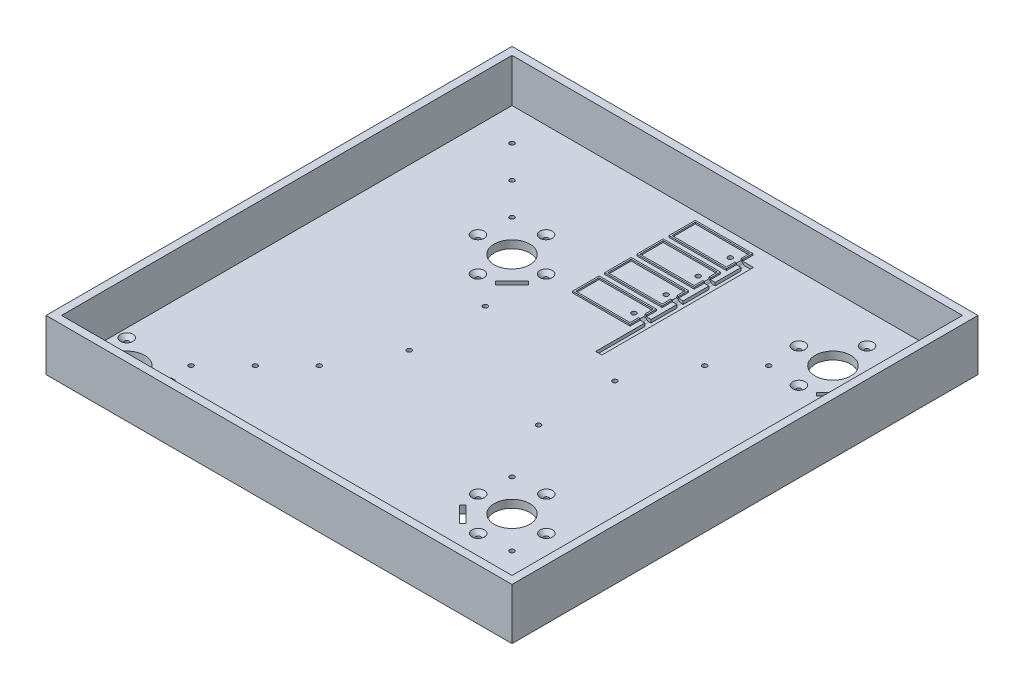
from build123d import *

# Parameters (mm, degrees)
SKETCH_1_W           = 300
SKETCH_1_H           = 300
SKETCH_1_R           = 11.5
SKETCH_1_R_2         = 1.5
EXTRUDE_1_DEPTH      = 5
SKETCH_2_W           = 5
SKETCH_2_H           = 300
EXTRUDE_2_DEPTH      = 28
SKETCH_3_W           = 5
SKETCH_3_H           = 300
EXTRUDE_3_DEPTH      = 28
SKETCH_4_W           = 290
SKETCH_4_H           = 5
EXTRUDE_4_DEPTH      = 28
SKETCH_5_W           = 290
SKETCH_5_H           = 5
EXTRUDE_5_DEPTH      = 28
CHAMFER_1_SIZE       = 2.5
CHAMFER_2_SIZE       = 2.5
CHAMFER_3_SIZE       = 2.5
CHAMFER_4_SIZE       = 2.5
CHAMFER_5_SIZE       = 2.5
SKETCH_6_W           = 37
SKETCH_6_H           = 17
SKETCH_6_W_2         = 35
SKETCH_6_H_2         = 15
EXTRUDE_6_DEPTH      = 1
SKETCH_7_W           = 37
SKETCH_7_H           = 17
SKETCH_7_W_2         = 35
SKETCH_7_H_2         = 15
EXTRUDE_7_DEPTH      = 1
SKETCH_8_W           = 37
SKETCH_8_H           = 17
SKETCH_8_W_2         = 35
SKETCH_8_H_2         = 15
EXTRUDE_8_DEPTH      = 1
SKETCH_8_2_W         = 37
SKETCH_8_2_H         = 17
SKETCH_8_2_W_2       = 35
SKETCH_8_2_H_2       = 15
EXTRUDE_9_DEPTH      = 1
SKETCH_10_W          = 37
SKETCH_10_H          = 17
SKETCH_10_W_2        = 35
SKETCH_10_H_2        = 15
EXTRUDE_10_DEPTH     = 1
CUT_EXTRUDE_1_DEPTH  = 2
SKETCH_12_W          = 1
SKETCH_12_H          = 4
CUT_EXTRUDE_2_DEPTH  = 2
SKETCH_13_W          = 4
SKETCH_13_H          = 93.669015838
CUT_EXTRUDE_3_DEPTH  = 2
CUT_EXTRUDE_4_DEPTH  = 2
SKETCH_15_W          = 3
SKETCH_15_H          = 4
CUT_EXTRUDE_5_DEPTH  = 2
FILLET_1_R           = 2
FILLET_2_R           = 2
FILLET_3_R           = 2
FILLET_5_R           = 2
FILLET_6_R           = 2
FILLET_7_R           = 2
CUT_EXTRUDE_6_DEPTH  = 2
SKETCH_17_W          = 3
SKETCH_17_H          = 4.004139154
CUT_EXTRUDE_8_DEPTH  = 2
FILLET_10_R          = 2
FILLET_11_R          = 2
FILLET_12_R          = 2
CUT_EXTRUDE_9_DEPTH  = 2
SKETCH_19_W          = 3
SKETCH_19_H          = 3.996204012
CUT_EXTRUDE_10_DEPTH = 2
FILLET_15_R          = 2
FILLET_17_R          = 1
FILLET_18_R          = 2


# Some blends are built 0.0001 mm under size
with BuildPart() as part:
    # Эскиз1 → Бобышка-Вытянуть1 (new body)
    with BuildSketch(Plane(origin=(0, 0, 0), x_dir=(1, 0, 0), z_dir=(0, 1, 0))):
        with Locations((13.889751591, -46.476805254)):
            Rectangle(SKETCH_1_W, SKETCH_1_H)
        with Locations(Location((-48.131063689, 15.544010026, 0), (0, 0, 270))):
            Circle(SKETCH_1_R, mode=Mode.SUBTRACT)
        with Locations(Location((-89.42609971, 56.839046048, 0), (0, 0, 270))):
            Circle(SKETCH_1_R_2, mode=Mode.SUBTRACT)
        with Locations(Location((-110.109177008, 77.522123345, 0), (0, 0, 270))):
            Circle(SKETCH_1_R_2, mode=Mode.SUBTRACT)
        with Locations(Location((-110.110248409, -170.476805254, 0), (0, 0, 270))):
            Circle(SKETCH_1_R, mode=Mode.SUBTRACT)
        with Locations(Location((-125.610248409, -154.976805254, 0), (0, 0, 270))):
            Circle(SKETCH_1_R_2, mode=Mode.SUBTRACT)
        with Locations(Location((-125.610248409, -185.976805254, 0), (0, 0, 270))):
            Circle(SKETCH_1_R_2, mode=Mode.SUBTRACT)
        with Locations(Location((-94.610248409, -185.976805254, 0), (0, 0, 270))):
            Circle(SKETCH_1_R_2, mode=Mode.SUBTRACT)
        with Locations(Location((-89.42609971, -149.792656555, 0), (0, 0, 270))):
            Circle(SKETCH_1_R_2, mode=Mode.SUBTRACT)
        with Locations(Location((-68.7785817, -129.145138545, 0), (0, 0, 270))):
            Circle(SKETCH_1_R_2, mode=Mode.SUBTRACT)
        with Locations(Location((-48.131063689, -108.497620534, 0), (0, 0, 270))):
            Circle(SKETCH_1_R_2, mode=Mode.SUBTRACT)
        with Locations(Location((-68.7785817, 36.191528037, 0), (0, 0, 270))):
            Circle(SKETCH_1_R_2, mode=Mode.SUBTRACT)
        with Locations(Location((-48.131063689, 37.464321001, 0), (0, 0, 270))):
            Circle(SKETCH_1_R_2, mode=Mode.SUBTRACT)
        with Locations(Location((-70.051373148, 15.544010026, 0), (0, 0, 270))):
            Circle(SKETCH_1_R_2, mode=Mode.SUBTRACT)
        with Locations(Location((-26.21075423, 15.544010026, 0), (0, 0, 270))):
            Circle(SKETCH_1_R_2, mode=Mode.SUBTRACT)
        with Locations(Location((-48.131063689, -6.376300948, 0), (0, 0, 270))):
            Circle(SKETCH_1_R_2, mode=Mode.SUBTRACT)
        with Locations(Location((75.910566871, -108.497620534, 0), (0, 0, 270))):
            Circle(SKETCH_1_R_2, mode=Mode.SUBTRACT)
        with Locations(Location((96.558084882, -129.145138545, 0), (0, 0, 270))):
            Circle(SKETCH_1_R, mode=Mode.SUBTRACT)
        with Locations(Location((117.205602893, -149.792656555, 0), (0, 0, 270))):
            Circle(SKETCH_1_R_2, mode=Mode.SUBTRACT)
        with Locations(Location((137.888476242, -170.475529905, 0), (0, 0, 270))):
            Circle(SKETCH_1_R_2, mode=Mode.SUBTRACT)
        with Locations(Location((96.558084882, -107.056013031, 0), (0, 0, 270))):
            Circle(SKETCH_1_R_2, mode=Mode.SUBTRACT)
        with Locations(Location((74.637774665, -128.976323247, 0), (0, 0, 270))):
            Circle(SKETCH_1_R_2, mode=Mode.SUBTRACT)
        with Locations(Location((96.558084882, -150.896633464, 0), (0, 0, 270))):
            Circle(SKETCH_1_R_2, mode=Mode.SUBTRACT)
        with Locations(Location((118.478395099, -128.976323247, 0), (0, 0, 270))):
            Circle(SKETCH_1_R_2, mode=Mode.SUBTRACT)
        with Locations(Location((75.910566871, 15.544010026, 0), (0, 0, 270))):
            Circle(SKETCH_1_R_2, mode=Mode.SUBTRACT)
        with Locations(Location((96.558084882, 36.191528037, 0), (0, 0, 270))):
            Circle(SKETCH_1_R_2, mode=Mode.SUBTRACT)
        with Locations(Location((117.205602893, 56.839046048, 0), (0, 0, 270))):
            Circle(SKETCH_1_R, mode=Mode.SUBTRACT)
        with Locations(Location((137.888476242, 77.521919397, 0), (0, 0, 270))):
            Circle(SKETCH_1_R_2, mode=Mode.SUBTRACT)
        with Locations(Location((117.205602893, 78.759354557, 0), (0, 0, 270))):
            Circle(SKETCH_1_R_2, mode=Mode.SUBTRACT)
        with Locations(Location((95.285290968, 56.839046048, 0), (0, 0, 270))):
            Circle(SKETCH_1_R_2, mode=Mode.SUBTRACT)
        with Locations(Location((139.125914817, 56.839046048, 0), (0, 0, 270))):
            Circle(SKETCH_1_R_2, mode=Mode.SUBTRACT)
        with Locations(Location((117.205602893, 34.918737538, 0), (0, 0, 270))):
            Circle(SKETCH_1_R_2, mode=Mode.SUBTRACT)
        with Locations(Location((-27.760248409, -21.956805254, 0), (0, 0, 270))):
            Circle(SKETCH_1_R_2, mode=Mode.SUBTRACT)
        with Locations(Location((-27.760248409, -70.996805254, 0), (0, 0, 270))):
            Circle(SKETCH_1_R_2, mode=Mode.SUBTRACT)
        with Locations(Location((55.539751591, -70.996805254, 0), (0, 0, 270))):
            Circle(SKETCH_1_R_2, mode=Mode.SUBTRACT)
        with Locations(Location((55.539751591, -21.956805254, 0), (0, 0, 270))):
            Circle(SKETCH_1_R_2, mode=Mode.SUBTRACT)
        with Locations(Location((23.889392584, 84.021593944, 0), (0, 0, 270))):
            Circle(SKETCH_1_R_2, mode=Mode.SUBTRACT)
        with Locations(Location((23.889392584, 63.339046048, 0), (0, 0, 270))):
            Circle(SKETCH_1_R_2, mode=Mode.SUBTRACT)
        with Locations(Location((23.889392584, 42.691528037, 0), (0, 0, 270))):
            Circle(SKETCH_1_R_2, mode=Mode.SUBTRACT)
        with Locations(Location((23.889751591, 22.044010026, 0), (0, 0, 270))):
            Circle(SKETCH_1_R_2, mode=Mode.SUBTRACT)
        Polygon((-33.281821797, 0.694767108), (-38.585122473, -4.608533934), (-36.463802056, -6.729854204), (-25.857200705, 3.87674788), (-27.978521122, 5.99806815), align=None, mode=Mode.SUBTRACT)
        Polygon((81.708842477, -143.825565652), (76.833324359, -138.950047534), (74.712004015, -141.071367877), (80.015304874, -146.374668736), (84.890822992, -151.250186855), (87.012143336, -149.128866511), align=None, mode=Mode.SUBTRACT)
        Polygon((132.054846454, 41.989804799), (126.751545182, 36.686504354), (128.872865361, 34.565183845), (134.176166633, 39.868484291), (139.479467905, 45.171784736), (137.358147726, 47.293105245), align=None, mode=Mode.SUBTRACT)
        Polygon((-89.110248409, -170.476805254), (-89.110248409, -162.976805254), (-86.110248409, -162.976805254), (-86.110248409, -168.23739185), (-86.110248409, -177.976805254), (-89.110248409, -177.976805254), align=None, mode=Mode.SUBTRACT)
    extrude(amount=EXTRUDE_1_DEPTH)

    # Эскиз2 → Бобышка-Вытянуть2 (add)
    with BuildSketch(Plane(origin=(0, 5, 0), x_dir=(1, 0, 0), z_dir=(0, 1, 0))):
        with Locations((-133.610248409, -46.476805254)):
            Rectangle(SKETCH_2_W, SKETCH_2_H)
    extrude(amount=EXTRUDE_2_DEPTH)

    # Эскиз3 → Бобышка-Вытянуть3 (add)
    with BuildSketch(Plane(origin=(0, 5, 0), x_dir=(1, 0, 0), z_dir=(0, 1, 0))):
        with Locations((161.389751591, -46.476805254)):
            Rectangle(SKETCH_3_W, SKETCH_3_H)
    extrude(amount=EXTRUDE_3_DEPTH)

    # Эскиз4 → Бобышка-Вытянуть4 (add)
    with BuildSketch(Plane(origin=(0, 5, 0), x_dir=(1, 0, 0), z_dir=(0, 1, 0))):
        with Locations((13.889751591, -193.976805254)):
            Rectangle(SKETCH_4_W, SKETCH_4_H)
    extrude(amount=EXTRUDE_4_DEPTH)

    # Эскиз5 → Бобышка-Вытянуть5 (add)
    with BuildSketch(Plane(origin=(0, 5, 0), x_dir=(1, 0, 0), z_dir=(0, 1, 0))):
        with Locations((13.889751591, 101.023194746)):
            Rectangle(SKETCH_5_W, SKETCH_5_H)
    extrude(amount=EXTRUDE_5_DEPTH)

    # Фаска1
    chamfer_1_edges = [part.edges().sort_by_distance(p)[0] for p in [
        (-48.131063689, 5, -38.964321001),
        (-70.051373148, 5, -17.044010026),
        (-26.21075423, 5, -17.044010026),
        (-48.131063689, 5, 4.876300948),
    ]]
    chamfer(chamfer_1_edges, length=CHAMFER_1_SIZE)

    # Фаска2
    chamfer_2_edges = [part.edges().sort_by_distance(p)[0] for p in [
        (117.205602893, 5, -80.259354557),
        (95.285290968, 5, -58.339046048),
        (139.125914817, 5, -58.339046048),
        (117.205602893, 5, -36.418737538),
    ]]
    chamfer(chamfer_2_edges, length=CHAMFER_2_SIZE)

    # Фаска3
    chamfer_3_edges = [part.edges().sort_by_distance(p)[0] for p in [
        (74.637774665, 5, 127.476323247),
        (96.558084882, 5, 149.396633464),
        (118.478395099, 5, 127.476323247),
        (96.558084882, 5, 105.556013031),
    ]]
    chamfer(chamfer_3_edges, length=CHAMFER_3_SIZE)

    # Фаска4
    chamfer_4_edges = [part.edges().sort_by_distance(p)[0] for p in [
        (-125.610248409, 5, 153.476805254),
        (-125.610248409, 5, 184.476805254),
        (-94.610248409, 5, 184.476805254),
    ]]
    chamfer(chamfer_4_edges, length=CHAMFER_4_SIZE)

    # Фаска5
    chamfer_5_edges = [part.edges().sort_by_distance(p)[0] for p in [
        (75.910566871, 0, -17.044010026),
        (96.558084882, 0, -37.691528037),
        (137.888476242, 0, -79.021919397),
        (-89.42609971, 0, -58.339046048),
        (-27.760248409, 0, 20.456805254),
        (-27.760248409, 0, 69.496805254),
        (55.539751591, 0, 69.496805254),
        (55.539751591, 0, 20.456805254),
        (-110.109177008, 0, -79.022123345),
        (-68.7785817, 0, -37.691528037),
        (-89.42609971, 0, 148.292656555),
        (-68.7785817, 0, 127.645138545),
        (-48.131063689, 0, 106.997620534),
        (75.910566871, 0, 106.997620534),
        (117.205602893, 0, 148.292656555),
        (137.888476242, 0, 168.975529905),
    ]]
    chamfer(chamfer_5_edges, length=CHAMFER_5_SIZE)

    # Эскиз6 → Бобышка-Вытянуть6 (add)
    with BuildSketch(Plane(origin=(0, 5, 0), x_dir=(1, 0, 0), z_dir=(0, 1, 0))):
        with Locations((11.389751591, 84.023194746)):
            Rectangle(SKETCH_6_W, SKETCH_6_H)
        with Locations((11.389751591, 84.023194746)):
            Rectangle(SKETCH_6_W_2, SKETCH_6_H_2, mode=Mode.SUBTRACT)
    extrude(amount=EXTRUDE_6_DEPTH)

    # Эскиз7 → Бобышка-Вытянуть7 (add)
    with BuildSketch(Plane(origin=(0, 5, 0), x_dir=(1, 0, 0), z_dir=(0, 1, 0))):
        with Locations((11.389751591, 63.343194746)):
            Rectangle(SKETCH_7_W, SKETCH_7_H)
        with Locations((11.389751591, 63.343194746)):
            Rectangle(SKETCH_7_W_2, SKETCH_7_H_2, mode=Mode.SUBTRACT)
    extrude(amount=EXTRUDE_7_DEPTH)

    # Эскиз8 → Бобышка-Вытянуть8 (add)
    with BuildSketch(Plane(origin=(0, 5, 0), x_dir=(1, 0, 0), z_dir=(0, 1, 0))):
        with Locations((11.389751591, 42.693194746)):
            Rectangle(SKETCH_8_W, SKETCH_8_H)
        with Locations((11.389751591, 42.693194746)):
            Rectangle(SKETCH_8_W_2, SKETCH_8_H_2, mode=Mode.SUBTRACT)
    extrude(amount=EXTRUDE_8_DEPTH)

    # Эскиз8<2> → Бобышка-Вытянуть9 (add)
    with BuildSketch(Plane(origin=(0, 5, 0), x_dir=(1, 0, 0), z_dir=(0, 1, 0))):
        with Locations((11.389751591, 42.693194746)):
            Rectangle(SKETCH_8_2_W, SKETCH_8_2_H)
        with Locations((11.389751591, 42.693194746)):
            Rectangle(SKETCH_8_2_W_2, SKETCH_8_2_H_2, mode=Mode.SUBTRACT)
    extrude(amount=EXTRUDE_9_DEPTH)

    # Эскиз10 → Бобышка-Вытянуть10 (add)
    with BuildSketch(Plane(origin=(0, 5, 0), x_dir=(1, 0, 0), z_dir=(0, 1, 0))):
        with Locations((11.389751591, 22.043194746)):
            Rectangle(SKETCH_10_W, SKETCH_10_H)
        with Locations((11.389751591, 22.043194746)):
            Rectangle(SKETCH_10_W_2, SKETCH_10_H_2, mode=Mode.SUBTRACT)
    extrude(amount=EXTRUDE_10_DEPTH)

    # Эскиз11 → Вырез-Вытянуть1 (cut)
    with BuildSketch(Plane(origin=(0, 5, 0), x_dir=(1, 0, 0), z_dir=(0, 1, 0))):
        Polygon((29.889751591, 84.023194746), (29.889751591, 82.023194746), (36.889751591, 82.023194746), (36.889751591, 84.975583948), (36.889751591, 86.023194746), (29.889751591, 86.023194746), align=None)
    extrude(amount=-CUT_EXTRUDE_1_DEPTH, mode=Mode.SUBTRACT)

    # Эскиз12 → Вырез-Вытянуть2 (cut)
    with BuildSketch(Plane(origin=(0, 6, 0), x_dir=(1, 0, 0), z_dir=(0, 1, 0))):
        with Locations((29.389751591, 84.023194746)):
            Rectangle(SKETCH_12_W, SKETCH_12_H)
    extrude(amount=-CUT_EXTRUDE_2_DEPTH, mode=Mode.SUBTRACT)

    # Эскиз13 → Вырез-Вытянуть3 (cut)
    with BuildSketch(Plane(origin=(0, 5, 0), x_dir=(1, 0, 0), z_dir=(0, 1, 0))):
        with Locations((34.889751591, 35.188686827)):
            Rectangle(SKETCH_13_W, SKETCH_13_H)
    extrude(amount=-CUT_EXTRUDE_3_DEPTH, mode=Mode.SUBTRACT)

    # Эскиз14 → Вырез-Вытянуть4 (cut)
    with BuildSketch(Plane(origin=(0, 6, 0), x_dir=(1, 0, 0), z_dir=(0, 1, 0))):
        Polygon((28.889751591, 63.343194746), (28.889751591, 65.343194746), (29.889751591, 65.343194746), (29.889751591, 63.343194746), (29.889751591, 61.343194746), (28.889751591, 61.343194746), align=None)
    extrude(amount=-CUT_EXTRUDE_4_DEPTH, mode=Mode.SUBTRACT)

    # Эскиз15 → Вырез-Вытянуть5 (cut)
    with BuildSketch(Plane(origin=(0, 5, 0), x_dir=(1, 0, 0), z_dir=(0, 1, 0))):
        with Locations((31.389751591, 63.343194746)):
            Rectangle(SKETCH_15_W, SKETCH_15_H)
    extrude(amount=-CUT_EXTRUDE_5_DEPTH, mode=Mode.SUBTRACT)

    # Скругление1
    # the kernel refuses this fillet: 2 mm, written as the material it adds along each edge
    with BuildSketch(Plane(origin=(28.889751591, 4, -88.523194746), x_dir=(1, 0, 0), z_dir=(0, 0, 1))) as fillet_1_piece_1:
        with BuildLine():
            CenterArc((1.822875656, 1.822875656), FILLET_1_R, 204.295188945, 41.409622109)
            Line((0, 1), (0, 0))
            Line((0, 0), (1, 0))
        make_face()
    extrude(amount=9)

    # Скругление2
    # the kernel refuses this fillet: 2 mm, written as the material it adds along each edge
    with BuildSketch(Plane(origin=(29.889751591, 3, -90.353321765), x_dir=(1, 0, 0), z_dir=(0, 0, 1))) as fillet_2_piece_1:
        with BuildLine():
            CenterArc((1.732050808, 2), FILLET_2_R, 210, 60)
            Line((0, 1), (-0.034641016, 0.98))
            ThreePointArc((-0.034641016, 0.98), (-0.04, 0.5), (-0.04, 0))
            Line((-0.04, 0), (0, -0.04))
            Line((0, -0.04), (1.732050808, -0.04))
            Line((1.732050808, -0.04), (1.732050808, 0))
        make_face()
    extrude(amount=12.660254038)

    # Скругление3
    fillet_3_edges = [part.edges().sort_by_distance(p)[0] for p in [
        (29.889751591, 4, -84.023194746),
    ]]
    fillet(fillet_3_edges, radius=FILLET_3_R)

    # Скругление5
    # the kernel refuses this fillet: 2 mm, written as the material it adds along each edge
    with BuildSketch(Plane(origin=(28.889751591, 4, -67.843194746), x_dir=(1, 0, 0), z_dir=(0, 0, 1))) as fillet_5_piece_1:
        with BuildLine():
            CenterArc((1.822875656, 1.822875656), FILLET_5_R, 204.295188945, 41.409622109)
            Line((0, 1), (0, 0))
            Line((0, 0), (1, 0))
        make_face()
    extrude(amount=9)

    # Скругление6
    # the kernel refuses this fillet: 2 mm, written as the material it adds along each edge
    with BuildSketch(Plane(origin=(29.889751591, 3, -57.013067727), x_dir=(1, 0, 0), z_dir=(0, 0, -1))) as fillet_6_piece_1:
        with BuildLine():
            CenterArc((1.732050808, -2), FILLET_6_R, 90, 60)
            Line((0, -1), (-0.034641016, -0.98))
            ThreePointArc((-0.034641016, -0.98), (-0.04, -0.5), (-0.04, 0))
            Line((-0.04, 0), (0, 0.04))
            Line((0, 0.04), (1.732050808, 0.04))
            Line((1.732050808, 0.04), (1.732050808, 0))
        make_face()
    extrude(amount=12.660254038)

    # Скругление7
    fillet_7_edges = [part.edges().sort_by_distance(p)[0] for p in [
        (29.889751591, 4, -63.343194746),
    ]]
    fillet(fillet_7_edges, radius=FILLET_7_R)

    # Эскиз16 → Вырез-Вытянуть6 (cut)
    with BuildSketch(Plane(origin=(0, 6, 0), x_dir=(1, 0, 0), z_dir=(0, 1, 0))):
        Polygon((29.889751591, 42.693194746), (29.889751591, 44.693194746), (28.889751591, 44.693194746), (28.889751591, 42.693194746), (28.889751591, 40.693194746), (29.889751591, 40.693194746), align=None)
    extrude(amount=-CUT_EXTRUDE_6_DEPTH, mode=Mode.SUBTRACT)

    # Эскиз17 → Вырез-Вытянуть8 (cut)
    with BuildSketch(Plane(origin=(0, 5, 0), x_dir=(1, 0, 0), z_dir=(0, 1, 0))):
        with Locations((31.389751591, 42.691125169)):
            Rectangle(SKETCH_17_W, SKETCH_17_H)
    extrude(amount=-CUT_EXTRUDE_8_DEPTH, mode=Mode.SUBTRACT)

    # Скругление10
    # the kernel refuses this fillet: 2 mm, written as the material it adds along each edge
    with BuildSketch(Plane(origin=(28.889751591, 4, -47.193194746), x_dir=(1, 0, 0), z_dir=(0, 0, 1))) as fillet_10_piece_1:
        with BuildLine():
            CenterArc((1.822875656, 1.822875656), FILLET_10_R, 204.295188945, 41.409622109)
            Line((0, 1), (0, 0))
            Line((0, 0), (1, 0))
        make_face()
    extrude(amount=9)

    # Скругление11
    fillet_11_edges = [part.edges().sort_by_distance(p)[0] for p in [
        (29.889751591, 3, -42.691125169),
    ]]
    fillet(fillet_11_edges, radius=FILLET_11_R)

    # Скругление12
    fillet_12_edges = [part.edges().sort_by_distance(p)[0] for p in [
        (30.231716133, 3.881555357, -42.693194746),
    ]]
    fillet(fillet_12_edges, radius=FILLET_12_R)

    # Эскиз18 → Вырез-Вытянуть9 (cut)
    with BuildSketch(Plane(origin=(0, 6, 0), x_dir=(1, 0, 0), z_dir=(0, 1, 0))):
        Polygon((29.889751591, 22.043194746), (29.889751591, 24.043194746), (28.889751591, 24.043194746), (28.889751591, 22.043194746), (28.889751591, 20.043194746), (29.889751591, 20.043194746), align=None)
    extrude(amount=-CUT_EXTRUDE_9_DEPTH, mode=Mode.SUBTRACT)

    # Эскиз19 → Вырез-Вытянуть10 (cut)
    with BuildSketch(Plane(origin=(0, 5, 0), x_dir=(1, 0, 0), z_dir=(0, 1, 0))):
        with Locations((31.389751591, 22.04509274)):
            Rectangle(SKETCH_19_W, SKETCH_19_H)
    extrude(amount=-CUT_EXTRUDE_10_DEPTH, mode=Mode.SUBTRACT)

    # Скругление15
    # the kernel refuses this fillet: 2 mm, written as the material it adds along each edge
    with BuildSketch(Plane(origin=(29.889751591, 3, -15.716863715), x_dir=(1, 0, 0), z_dir=(0, 0, -1))) as fillet_15_piece_1:
        with BuildLine():
            CenterArc((1.732050808, -2), FILLET_15_R, 90, 60)
            Line((0, -1), (-0.034641016, -0.98))
            ThreePointArc((-0.034641016, -0.98), (-0.04, -0.5), (-0.04, 0))
            Line((-0.04, 0), (0, 0.04))
            Line((0, 0.04), (1.732050808, 0.04))
            Line((1.732050808, 0.04), (1.732050808, 0))
        make_face()
    extrude(amount=12.65645805)

    # Скругление17
    fillet_17_edges = [part.edges().sort_by_distance(p)[0] for p in [
        (28.889751591, 4, -22.043194746),
    ]]
    fillet(fillet_17_edges, radius=FILLET_17_R - 0.0001)  # a hair under: the kernel refuses the full size

    # Скругление18
    # the kernel refuses this fillet: 2 mm, written as the material it takes off along each edge
    with BuildSketch(Plane(origin=(29.889751591, 4, -20.046990734), x_dir=(-0.9805642877590565, 0.19619805700254597, 0), z_dir=(0, 0, -1))) as fillet_18_piece_1:
        with BuildLine():
            CenterArc((0.785145157, -1.961089332), FILLET_18_R, 101.320447966, 23.557737193)
            Line((-0.358521976, -0.320350021), (-0.472888689, -0.156276089))
            ThreePointArc((-0.472888689, -0.156276089), (-0.302858535, -0.021849947), (-0.150218911, 0.132038929))
            Line((-0.150218911, 0.132038929), (0.039239611, 0.196112858))
            ThreePointArc((0.039239611, 0.196112858), (0.039337668, 0.196093238), (0.353293742, 0.196108933))
            Line((0.353293742, 0.196108933), (0.392552962, 0))
        make_face()
    extrude(amount=3.996204012, mode=Mode.SUBTRACT)


solid = part.part
